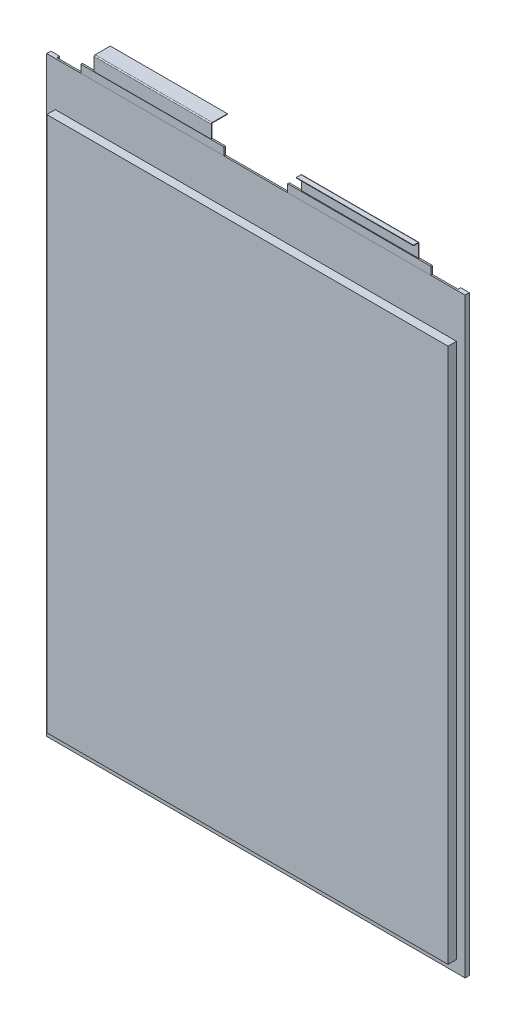
from build123d import *

# Parameters (mm, degrees)
INSULATION_DEPTH      = 0.3
INSULATION_DEPTH_BACK = 0.3
SKETCH1_W             = 160.6
SKETCH1_H             = 227
MAIN_BODY_DEPTH       = 3.55
MAIN_BODY_DEPTH_BACK  = 3.55
SKETCH2_W             = 154
SKETCH2_H             = 205.5
SIDE_FOLDS_DEPTH      = 1.016
SKETCH114_W           = 55
SKETCH114_H           = 0.6
BOSS_EXTRUDE1_DEPTH   = 3
BOSS_EXTRUDE1_2_DEPTH = 3
BASE_FLANGE1_DEPTH    = 45
BASE_FLANGE2_DEPTH    = 45


# Sheet-metal steps are written as plain solids
with BuildPart() as part:
    # Sketch1 → Insulation (new, two sides: drawn at the far end of the back side and taken through both)
    with BuildSketch(Plane.XY.offset(-INSULATION_DEPTH_BACK)):
        Rectangle(SKETCH1_W, SKETCH1_H)
    extrude(amount=INSULATION_DEPTH + INSULATION_DEPTH_BACK)

    # Sketch2 → Main Body (add, two sides: drawn at the far end of the back side and taken through both)
    with BuildSketch(Plane.XY.offset(-MAIN_BODY_DEPTH_BACK)):
        with Locations((0, -6.25)):
            Rectangle(SKETCH2_W, SKETCH2_H)
    extrude(amount=MAIN_BODY_DEPTH + MAIN_BODY_DEPTH_BACK)

    # Sketch5 → Side Folds (add)
    with BuildSketch(Plane(origin=(0, 0, -0.3), x_dir=(-1, 0, 0), z_dir=(0, 0, -1))):
        Polygon((-77, -109), (-77, 96.5), (-77, 113.5), (-80.3, 113.5), (-80.3, -113.5), (-77, -113.5), align=None)
        Polygon((77, 113.5), (77, 96.5), (77, -109), (77, -113.5), (80.3, -113.5), (80.3, 113.5), align=None)
    extrude(amount=SIDE_FOLDS_DEPTH)


with BuildPart() as body_2:
    # Sketch114 → Boss-Extrude1 (new body)
    with BuildSketch(Plane(origin=(0, 113.5, 0), x_dir=(1, 0, 0), z_dir=(0, 1, 0))):
        with Locations((-39.7, 0)):
            Rectangle(SKETCH114_W, SKETCH114_H)
    extrude(amount=BOSS_EXTRUDE1_DEPTH)


with BuildPart() as body_3:
    # Sketch114 → Boss-Extrude1 2 (new body)
    with BuildSketch(Plane(origin=(0, 113.5, 0), x_dir=(1, 0, 0), z_dir=(0, 1, 0))):
        with Locations((39.7, 0)):
            Rectangle(SKETCH114_W, SKETCH114_H)
    extrude(amount=BOSS_EXTRUDE1_2_DEPTH)


with BuildPart() as body_4:
    # Sketch115 → Base-Flange1 (new body)
    with BuildSketch(Plane.ZY.offset(62.2)):
        with BuildLine():
            Line((0, 116.5), (0, 121.5))
            ThreePointArc((0, 121.5), (-0.058578644, 121.641421356), (-0.2, 121.7))
            Line((-0.2, 121.7), (-6, 121.7))
            Line((-6, 121.7), (-6, 121.9))
            Line((-6, 121.9), (-0.2, 121.9))
            ThreePointArc((-0.2, 121.9), (0.082842712, 121.782842712), (0.2, 121.5))
            Line((0.2, 121.5), (0.2, 116.5))
            Line((0.2, 116.5), (0, 116.5))
        make_face()
    extrude(amount=-BASE_FLANGE1_DEPTH)


with BuildPart() as body_5:
    # Sketch120 → Base-Flange2 (new body)
    with BuildSketch(Plane(origin=(62.2, 0, 0), x_dir=(0, 0, -1), z_dir=(1, 0, 0))):
        with BuildLine():
            Line((0, 116.5), (0, 121.5))
            ThreePointArc((0, 121.5), (-0.058578644, 121.641421356), (-0.2, 121.7))
            Line((-0.2, 121.7), (-2, 121.7))
            Line((-2, 121.7), (-2, 121.9))
            Line((-2, 121.9), (-0.2, 121.9))
            ThreePointArc((-0.2, 121.9), (0.082842712, 121.782842712), (0.2, 121.5))
            Line((0.2, 121.5), (0.2, 116.5))
            Line((0.2, 116.5), (0, 116.5))
        make_face()
    extrude(amount=-BASE_FLANGE2_DEPTH)


solid = Compound([part.part, body_2.part, body_3.part, body_4.part, body_5.part])
